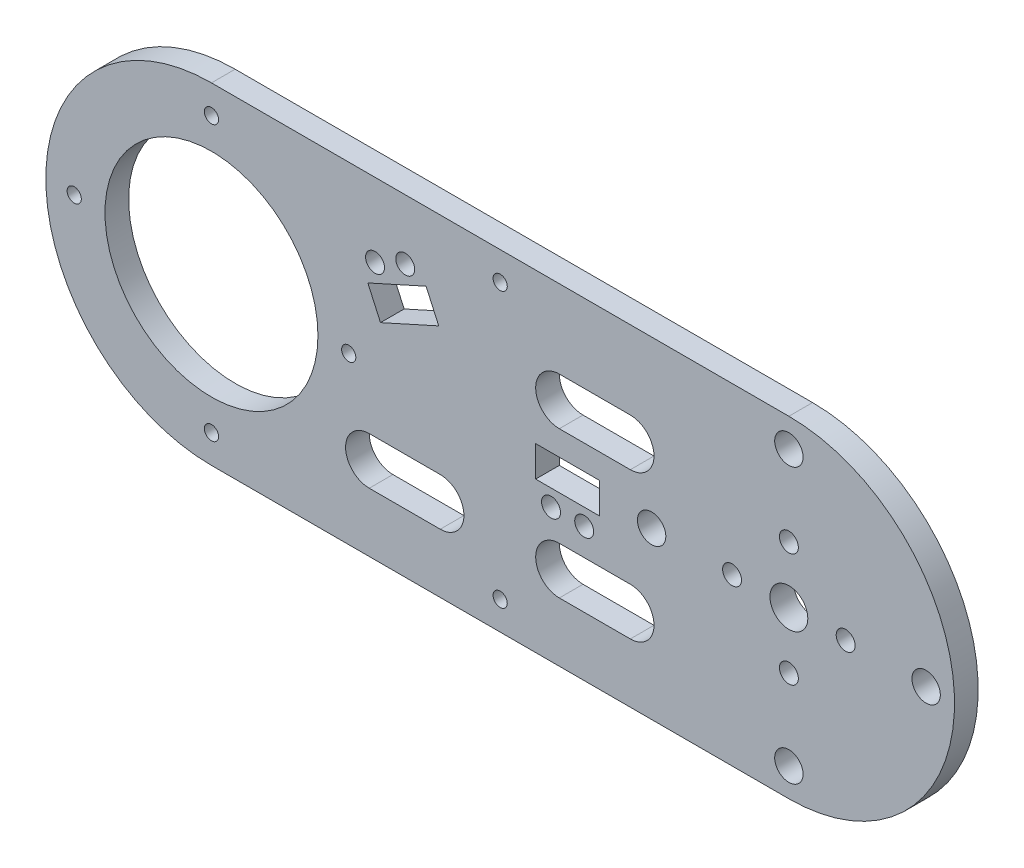
from build123d import *

# Parameters (mm, degrees)
SKETCH1_R           = 4
SKETCH1_R_2         = 22.5
SKETCH1_R_3         = 1.5
SKETCH1_R_4         = 3
SKETCH1_R_5         = 2
SKETCH1_W           = 13.5
SKETCH1_H           = 6.5
BOSS_EXTRUDE1_DEPTH = 5


with BuildPart() as part:
    # Sketch1 → Boss-Extrude1 (new body)
    with BuildSketch(Plane.XY):
        with BuildLine():
            Line((61, -35), (-61, -35))
            ThreePointArc((-61, -35), (-96, 0), (-61, 35))
            Line((-61, 35), (61, 35))
            ThreePointArc((61, 35), (96, 0), (61, -35))
        make_face()
        with Locations((61, 0)):
            Circle(SKETCH1_R, mode=Mode.SUBTRACT)
        with Locations((-61, 0)):
            Circle(SKETCH1_R_2, mode=Mode.SUBTRACT)
        with Locations((-61, -29)):
            Circle(SKETCH1_R_3, mode=Mode.SUBTRACT)
        with Locations((-61, 29)):
            Circle(SKETCH1_R_3, mode=Mode.SUBTRACT)
        with Locations((61, 29)):
            Circle(SKETCH1_R_4, mode=Mode.SUBTRACT)
        with Locations((61, -29)):
            Circle(SKETCH1_R_4, mode=Mode.SUBTRACT)
        with Locations((0, -29)):
            Circle(SKETCH1_R_3, mode=Mode.SUBTRACT)
        with Locations((0, 29)):
            Circle(SKETCH1_R_3, mode=Mode.SUBTRACT)
        with Locations((-90, 0)):
            Circle(SKETCH1_R_3, mode=Mode.SUBTRACT)
        with Locations((-32, 0)):
            Circle(SKETCH1_R_3, mode=Mode.SUBTRACT)
        with Locations((90, 0)):
            Circle(SKETCH1_R_4, mode=Mode.SUBTRACT)
        with Locations((32, 0)):
            Circle(SKETCH1_R_4, mode=Mode.SUBTRACT)
        with Locations((61, 12)):
            Circle(SKETCH1_R_5, mode=Mode.SUBTRACT)
        with Locations((61, -12)):
            Circle(SKETCH1_R_5, mode=Mode.SUBTRACT)
        with Locations((49, 0)):
            Circle(SKETCH1_R_5, mode=Mode.SUBTRACT)
        with Locations((73, 0)):
            Circle(SKETCH1_R_5, mode=Mode.SUBTRACT)
        with Locations((10.75, -6.75)):
            Circle(SKETCH1_R_5, mode=Mode.SUBTRACT)
        with Locations((17.75, -6.75)):
            Circle(SKETCH1_R_5, mode=Mode.SUBTRACT)
        with Locations((-20.05615201, 22.318183434)):
            Circle(SKETCH1_R_5, mode=Mode.SUBTRACT)
        with Locations((-26.436477609, 19.438696457)):
            Circle(SKETCH1_R_5, mode=Mode.SUBTRACT)
        with Locations((14.25, 0)):
            Rectangle(SKETCH1_W, SKETCH1_H, mode=Mode.SUBTRACT)
        with BuildLine():
            Line((-27.66, -12.5), (-12.66, -12.5))
            ThreePointArc((-12.66, -12.5), (-7.66, -17.5), (-12.66, -22.5))
            Line((-12.66, -22.5), (-27.66, -22.5))
            ThreePointArc((-27.66, -22.5), (-32.66, -17.5), (-27.66, -12.5))
        make_face(mode=Mode.SUBTRACT)
        with BuildLine():
            Line((12.5, -12.5), (27.5, -12.5))
            ThreePointArc((27.5, -12.5), (32.5, -17.5), (27.5, -22.5))
            Line((27.5, -22.5), (12.5, -22.5))
            ThreePointArc((12.5, -22.5), (7.5, -17.5), (12.5, -12.5))
        make_face(mode=Mode.SUBTRACT)
        with BuildLine():
            Line((12.5, 18.47), (27.5, 18.47))
            ThreePointArc((27.5, 18.47), (32.5, 13.47), (27.5, 8.47))
            Line((27.5, 8.47), (12.5, 8.47))
            ThreePointArc((12.5, 8.47), (7.5, 13.47), (12.5, 18.47))
        make_face(mode=Mode.SUBTRACT)
        Polygon((-27.959028149, 14.911628989), (-25.285218813, 8.987040933), (-12.980305157, 14.540337246), (-15.654114493, 20.464925302), align=None, mode=Mode.SUBTRACT)
    extrude(amount=BOSS_EXTRUDE1_DEPTH)


solid = part.part
